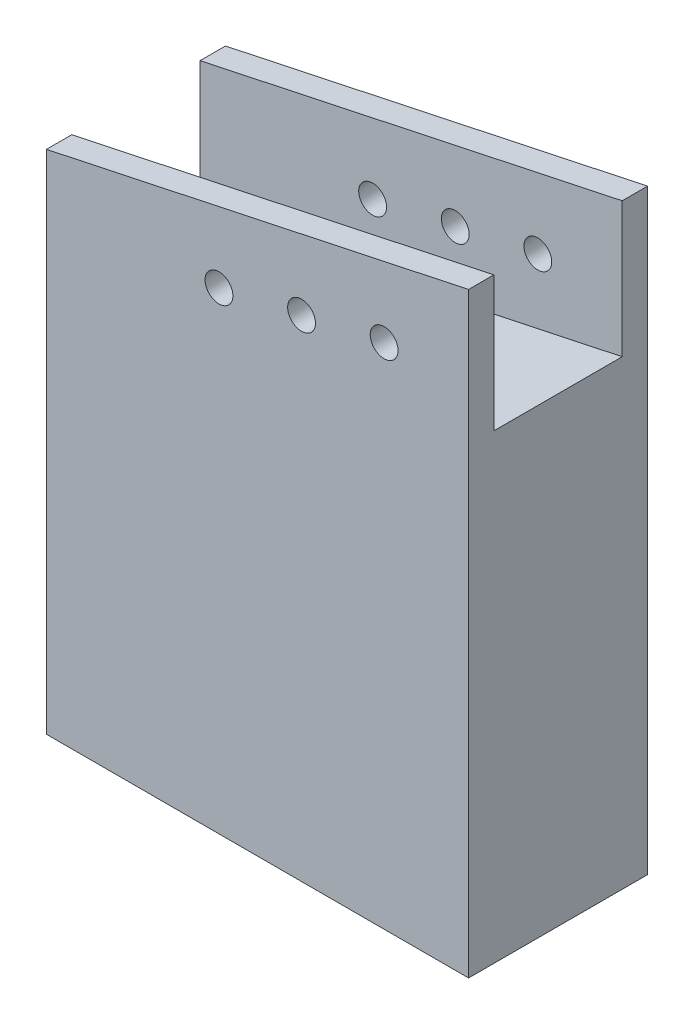
from build123d import *

# Parameters (mm, degrees)
SKETCH_1_W          = 50
SKETCH_1_H          = 60
EXTRUDE_1_DEPTH     = 10.6
EXTRUDE_2_DEPTH     = 3
EXTRUDE_START       = -18.2
EXTRUDE_3_DEPTH     = 3
SKETCH_3_W          = 15.2
SKETCH_3_H          = 16
SKETCH_4_R          = 1.65
CUT_EXTRUDE_1_DEPTH = 3


with BuildPart() as part:
    # 草图1 → 凸台-拉伸1 (new, symmetric)
    with BuildSketch(Plane.XY):
        Rectangle(SKETCH_1_W, SKETCH_1_H)
    extrude(amount=EXTRUDE_1_DEPTH, both=True)

    # 草图2 → 凸台-拉伸2 (add)
    with BuildSketch(Plane.XY.offset(10.6)):
        Polygon((-25, 30), (25, 30), (25, 40.627828084), align=None)
    extrude(amount=-EXTRUDE_2_DEPTH)

    # 草图2<2> → 凸台-拉伸3 (add)
    with BuildSketch(Plane.XY.offset(10.6).offset(EXTRUDE_START)):
        Polygon((-25, 30), (25, 30), (25, 40.627828084), align=None)
    extrude(amount=-EXTRUDE_3_DEPTH)

    # 切除-扫描1: sweep along a curve in space
    with BuildLine() as sweep_1_path:
        Line((25, 40.627828084, 10.6), (-25, 30, 10.6))
    # 草图3 → 切除-扫描1 (sweep, cut)
    with BuildSketch(Plane.ZY.offset(25)):
        with Locations((0, 22)):
            Rectangle(SKETCH_3_W, SKETCH_3_H)
    sweep(path=sweep_1_path.line, mode=Mode.SUBTRACT)

    # 草图4 → 切除-拉伸1 (cut)
    with BuildSketch(Plane.XY.offset(-7.6)):
        with Locations((-4.562952015, 26.011583112)):
            Circle(SKETCH_4_R)
        with Locations((5.218523993, 28.09070002)):
            Circle(SKETCH_4_R)
        with Locations((15, 30.169816928)):
            Circle(SKETCH_4_R)
    cut_extrude_1 = extrude(amount=-CUT_EXTRUDE_1_DEPTH, mode=Mode.SUBTRACT)

    # 镜向1: 切除-拉伸1 across plane
    add(cut_extrude_1.mirror(Plane.XY), mode=Mode.SUBTRACT)


solid = part.part
